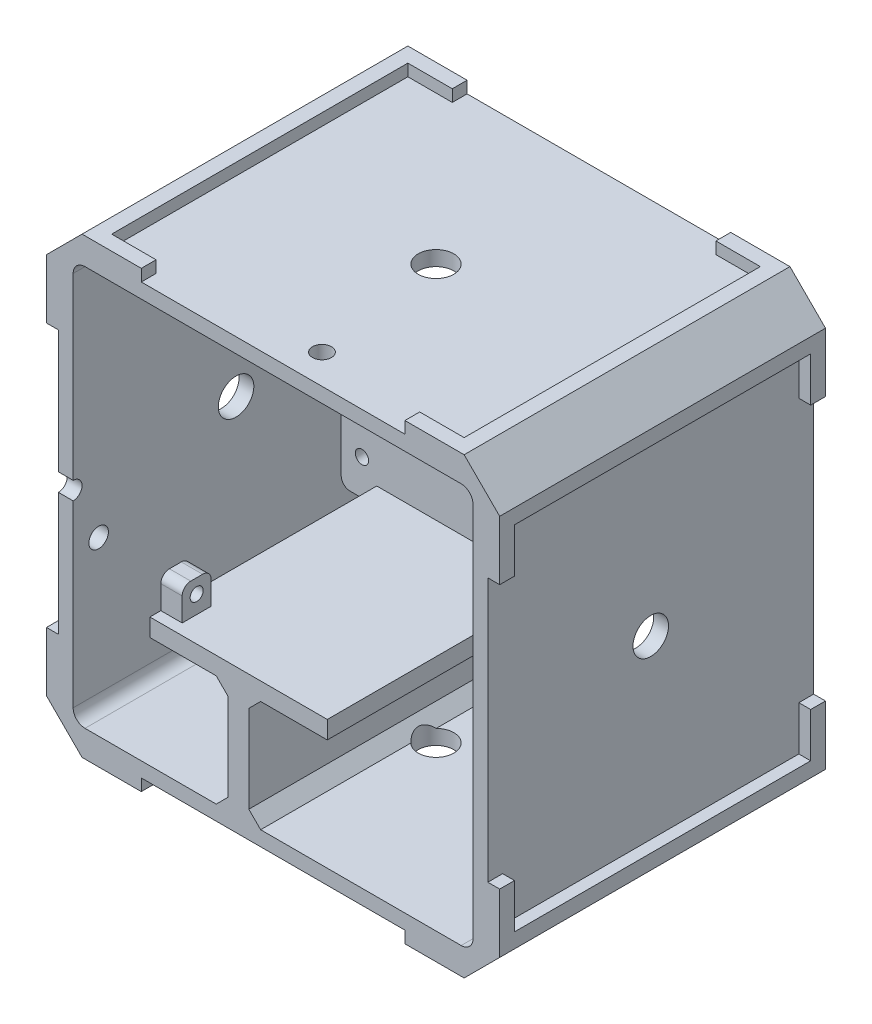
from build123d import *

# Parameters (mm, degrees)
BOSS_EXTRUDE1_DEPTH             = 55
SKETCH2_W                       = 67.5
SKETCH2_H                       = 67.5
BOSS_EXTRUDE2_DEPTH             = 2.5
CUT_EXTRUDE2_REACH              = 77.187
SKETCH4_R                       = 1.65
MIRROR2_COPY_1_REACH            = 77.187
MIRROR2_COPY_1_SKETCH_R         = 1.65
BOSS_EXTRUDE3_DEPTH             = 14.6
BOSS_EXTRUDE3_DEPTH_BACK        = 25.8
BOSS_EXTRUDE4_DEPTH             = 49.7
SKETCH7_W                       = 37.9
SKETCH7_H                       = 22.75
CUT_EXTRUDE3_DEPTH              = 8.4
BOSS_EXTRUDE7_DEPTH             = 2
CUT_EXTRUDE6_REACH              = 84.442
CUT_EXTRUDE6_DIRECTION_2_DEPTH  = 83.442009922
CUT_EXTRUDE8_DEPTH              = 103.907106169
CUT_EXTRUDE8_DEPTH_BACK         = 2.5
SKETCH15_R                      = 1.6
SKETCH16_W                      = 7.5
SKETCH16_H                      = 1.65
BOSS_EXTRUDE8_DEPTH             = 7
CUT_EXTRUDE9_REACH              = 74.438
SKETCH17_R                      = 1.125
SKETCH19_R                      = 3
CUT_EXTRUDE10_DEPTH             = 2.5
BOSS_EXTRUDE9_DEPTH             = 2
CIRPATTERN1_COUNT               = 4
CIRPATTERN2_COUNT               = 4
BOSS_EXTRUDE12_DEPTH            = 55
CUT_EXTRUDE12_REACH             = 75.459
SKETCH23_W                      = 6.5
SKETCH23_H                      = 16
CHAMFER1_SIZE                   = 0.75
CUT_EXTRUDE13_REACH             = 91.486
SKETCH25_W                      = 3
SKETCH25_H                      = 35
SKETCH25_W_2                    = 5
SKETCH25_H_2                    = 46.7
FILLET3_R                       = 1.5
SKETCH26_W                      = 12.543976605
SKETCH26_H                      = 9.586128164
CUT_EXTRUDE14_DEPTH             = 90.261665904
SKETCH27_W                      = 6.75
SKETCH27_H                      = 1.4
BOSS_EXTRUDE14_DEPTH            = 1.25
CHAMFER2_SIZE                   = 2
CUT_EXTRUDE15_REACH             = 85.744
SKETCH28_W                      = 7.624106446
SKETCH28_H                      = 46.373052842
SKETCH29_W                      = 40.4
SKETCH29_H                      = 3
BOSS_EXTRUDE15_DEPTH            = 18.75
BOSS_EXTRUDE16_DEPTH            = 4
CHAMFER3_SIZE                   = 0.75
CHAMFER3_OF_MIRROR3_SIZE        = 0.75
MIRROR4_START                   = 2.5
MIRROR4_DEPTH                   = 4
CUT_EXTRUDE16_REACH             = 102.191
SKETCH32_R                      = 1.5
CUT_EXTRUDE16_DIRECTION_2_DEPTH = 101.19137937
BOSS_EXTRUDE17_DEPTH            = 5
CUT_EXTRUDE17_REACH             = 68.28
SKETCH37_W                      = 5
SKETCH37_H                      = 18.75
SKETCH37_W_2                    = 5.675
BOSS_EXTRUDE18_DEPTH            = 5
BOSS_EXTRUDE19_DEPTH            = 3
FILLET4_R                       = 1.5
FILLET5_R                       = 1.5
SKETCH38_R                      = 1.1
BOSS_EXTRUDE20_DEPTH            = 3.6
SKETCH39_R                      = 1.75
CUT_EXTRUDE18_DEPTH             = 1.4
CUT_EXTRUDE19_REACH             = 102.191
SKETCH40_R                      = 1.65


with BuildPart() as part:
    # Sketch1 → Boss-Extrude1 (new body)
    with BuildSketch(Plane.XY):
        with BuildLine():
            Line((-36.25, 32.25), (-36.25, -32.25))
            ThreePointArc((-36.25, -32.25), (-35.078427125, -35.078427125), (-32.25, -36.25))
            Line((-32.25, -36.25), (32.25, -36.25))
            ThreePointArc((32.25, -36.25), (35.078427125, -35.078427125), (36.25, -32.25))
            Line((36.25, -32.25), (36.25, 32.25))
            ThreePointArc((36.25, 32.25), (35.078427125, 35.078427125), (32.25, 36.25))
            Line((32.25, 36.25), (-32.25, 36.25))
            ThreePointArc((-32.25, 36.25), (-35.078427125, 35.078427125), (-36.25, 32.25))
        make_face()
        with BuildLine():
            Line((-31.75, 33.75), (31.75, 33.75))
            ThreePointArc((31.75, 33.75), (33.164213562, 33.164213562), (33.75, 31.75))
            Line((33.75, 31.75), (33.75, -31.75))
            ThreePointArc((33.75, -31.75), (33.164213562, -33.164213562), (31.75, -33.75))
            Line((31.75, -33.75), (-31.75, -33.75))
            ThreePointArc((-31.75, -33.75), (-33.164213562, -33.164213562), (-33.75, -31.75))
            Line((-33.75, -31.75), (-33.75, 31.75))
            ThreePointArc((-33.75, 31.75), (-33.164213562, 33.164213562), (-31.75, 33.75))
        make_face(mode=Mode.SUBTRACT)
    extrude(amount=BOSS_EXTRUDE1_DEPTH)

    # Sketch2 → Boss-Extrude2 (add)
    with BuildSketch(Plane.XY):
        Rectangle(SKETCH2_W, SKETCH2_H)
    extrude(amount=BOSS_EXTRUDE2_DEPTH)

    # Sketch4 → Cut-Extrude2 (cut, up to next)
    with BuildSketch(Plane(origin=(0, 0, 0), x_dir=(-1, 0, 0), z_dir=(0, 0, -1)), mode=Mode.PRIVATE) as cut_extrude2_sk1:
        with Locations((-28.75, 28.75)):
            Circle(SKETCH4_R)
    cut_extrude2_tool1 = extrude(cut_extrude2_sk1.sketch, amount=-CUT_EXTRUDE2_REACH, mode=Mode.PRIVATE) & part.part
    cut_extrude2 = cut_extrude2_tool1.solids().sort_by_distance((28.75, 28.75, 0))[0]
    add(cut_extrude2, mode=Mode.SUBTRACT)

    # Mirror1: Cut-Extrude2 across plane
    add(cut_extrude2.mirror(Plane(origin=(0, 0, 0), x_dir=(0, 0, 1), z_dir=(1, 0, 0))), mode=Mode.SUBTRACT)

    # Mirror2: Cut-Extrude2 across plane
    add(cut_extrude2.mirror(Plane.ZX), mode=Mode.SUBTRACT)

    # Mirror2 copy 1 sketch → Mirror2 copy 1 (cut, up to next)
    with BuildSketch(Plane(origin=(0, 0, 0), x_dir=(1, 0, 0), z_dir=(0, 0, -1)), mode=Mode.PRIVATE) as mirror2_copy_1_sk1:
        with Locations((-28.75, 28.75)):
            Circle(MIRROR2_COPY_1_SKETCH_R)
    mirror2_copy_1_tool1 = extrude(mirror2_copy_1_sk1.sketch, amount=-MIRROR2_COPY_1_REACH, mode=Mode.PRIVATE) & part.part
    add(mirror2_copy_1_tool1.solids().sort_by_distance((-28.75, -28.75, 0))[0], mode=Mode.SUBTRACT)



with BuildPart() as body_2:
    # Sketch5 → Boss-Extrude3 (new, two sides: drawn at the far end of the back side and taken through both)
    with BuildSketch(Plane(origin=(0, 0, 0), x_dir=(0, 0, -1), z_dir=(1, 0, 0)).offset(-BOSS_EXTRUDE3_DEPTH_BACK)):
        Polygon((-16.7, 12), (-16.7, -12), (-60.4, -12), (-63.4, -12), (-63.4, -15), (-13.7, -15), (-13.7, 12), align=None)
    extrude(amount=BOSS_EXTRUDE3_DEPTH + BOSS_EXTRUDE3_DEPTH_BACK)


with BuildPart() as part_1:
    add(part.part)

    add(body_2.part)  # Boss-Extrude4 merges body 2
    # Sketch6 → Boss-Extrude4 (add)
    with BuildSketch(Plane.XY.offset(63.4)):
        Polygon((-25.8, -12), (12.1, -12), (12.1, -15), (-4.1, -15), (-4.1, -33.75), (12.1, -33.75), (12.1, -36.25), (-25.8, -36.25), (-25.8, -33.75), (-7.6, -33.75), (-7.6, -15), (-25.8, -15), align=None)
    extrude(amount=-BOSS_EXTRUDE4_DEPTH)

    # Sketch7 → Cut-Extrude3 (cut)
    with BuildSketch(Plane.XY.offset(63.4)):
        with Locations((-6.85, -24.875)):
            Rectangle(SKETCH7_W, SKETCH7_H)
    extrude(amount=-CUT_EXTRUDE3_DEPTH, mode=Mode.SUBTRACT)

    # Sketch12 → Boss-Extrude7 (add)
    with BuildSketch(Plane(origin=(0, 36.25, 0), x_dir=(1, 0, 0), z_dir=(0, 1, 0))):
        Polygon((29.75, -55), (32.25, -55), (32.25, -52.5), (32.25, -45), (29.75, -45), (29.75, -52.5), (22.25, -52.5), (22.25, -55), align=None)
        Polygon((-32.25, 0), (-32.25, -10), (-29.75, -10), (-29.75, -2.5), (-22.25, -2.5), (-22.25, 0), align=None)
    boss_extrude7 = extrude(amount=BOSS_EXTRUDE7_DEPTH)

    # Sketch13 → Cut-Extrude6 (cut, up to next)
    with BuildSketch(Plane(origin=(0, 0, 0), x_dir=(-1, 0, 0), z_dir=(0, 0, -1)), mode=Mode.PRIVATE) as cut_extrude6_sk1:
        with BuildLine():
            Line((-33.75, 21.25), (-25.25, 21.25))
            ThreePointArc((-25.25, 21.25), (-22.421572875, 22.421572875), (-21.25, 25.25))
            Line((-21.25, 25.25), (-21.25, 33.75))
            Line((-21.25, 33.75), (21.25, 33.75))
            Line((21.25, 33.75), (21.25, 25.25))
            ThreePointArc((21.25, 25.25), (22.421572875, 22.421572875), (25.25, 21.25))
            Line((25.25, 21.25), (33.75, 21.25))
            Line((33.75, 21.25), (33.75, -21.25))
            Line((33.75, -21.25), (25.25, -21.25))
            ThreePointArc((25.25, -21.25), (22.421572875, -22.421572875), (21.25, -25.25))
            Line((21.25, -25.25), (21.25, -33.75))
            Line((21.25, -33.75), (-21.25, -33.75))
            Line((-21.25, -33.75), (-21.25, -25.25))
            ThreePointArc((-21.25, -25.25), (-22.421572875, -22.421572875), (-25.25, -21.25))
            Line((-25.25, -21.25), (-33.75, -21.25))
            Line((-33.75, -21.25), (-33.75, 21.25))
        make_face()
    cut_extrude6_tool1 = extrude(cut_extrude6_sk1.sketch, amount=-CUT_EXTRUDE6_REACH, mode=Mode.PRIVATE) & part_1.part
    add(cut_extrude6_tool1.solids().sort_by_distance((0, 0, 0))[0], mode=Mode.SUBTRACT)

    # Sketch13 → Cut-Extrude6 direction 2 (cut)
    with BuildSketch(Plane(origin=(0, 0, 0), x_dir=(-1, 0, 0), z_dir=(0, 0, -1))):
        with BuildLine():
            Line((-33.75, 21.25), (-25.25, 21.25))
            ThreePointArc((-25.25, 21.25), (-22.421572875, 22.421572875), (-21.25, 25.25))
            Line((-21.25, 25.25), (-21.25, 33.75))
            Line((-21.25, 33.75), (21.25, 33.75))
            Line((21.25, 33.75), (21.25, 25.25))
            ThreePointArc((21.25, 25.25), (22.421572875, 22.421572875), (25.25, 21.25))
            Line((25.25, 21.25), (33.75, 21.25))
            Line((33.75, 21.25), (33.75, -21.25))
            Line((33.75, -21.25), (25.25, -21.25))
            ThreePointArc((25.25, -21.25), (22.421572875, -22.421572875), (21.25, -25.25))
            Line((21.25, -25.25), (21.25, -33.75))
            Line((21.25, -33.75), (-21.25, -33.75))
            Line((-21.25, -33.75), (-21.25, -25.25))
            ThreePointArc((-21.25, -25.25), (-22.421572875, -22.421572875), (-25.25, -21.25))
            Line((-25.25, -21.25), (-33.75, -21.25))
            Line((-33.75, -21.25), (-33.75, 21.25))
        make_face()
    extrude(amount=CUT_EXTRUDE6_DIRECTION_2_DEPTH, mode=Mode.SUBTRACT)

    # Sketch15 → Cut-Extrude8 (cut, two sides: drawn at the far end of the back side and taken through both)
    with BuildSketch(Plane(origin=(0, 36.25, 0), x_dir=(1, 0, 0), z_dir=(0, 1, 0)).offset(-CUT_EXTRUDE8_DEPTH_BACK)):
        with Locations(Location((3.25, -50, 0), (0, 0, 270))):
            Circle(SKETCH15_R)
    extrude(amount=CUT_EXTRUDE8_DEPTH + CUT_EXTRUDE8_DEPTH_BACK, mode=Mode.SUBTRACT)

    # Sketch16 → Boss-Extrude8 (add)
    with BuildSketch(Plane(origin=(-33.75, 0, 0), x_dir=(0, 0, -1), z_dir=(1, 0, 0))):
        with Locations((-16.5, 29.525)):
            Rectangle(SKETCH16_W, SKETCH16_H)
    extrude(amount=BOSS_EXTRUDE8_DEPTH)

    # Sketch17 → Cut-Extrude9 (cut, up to next)
    with BuildSketch(Plane(origin=(0, 0, 13.7), x_dir=(-1, 0, 0), z_dir=(0, 0, -1)), mode=Mode.PRIVATE) as cut_extrude9_sk1:
        with Locations(Location((-12.1, 9, 0), (0, 0, 90))):
            Circle(SKETCH17_R)
    cut_extrude9_tool1 = extrude(cut_extrude9_sk1.sketch, amount=-CUT_EXTRUDE9_REACH, mode=Mode.PRIVATE) & part_1.part
    # Sketch17 → Cut-Extrude9 (cut, up to next)
    with BuildSketch(Plane(origin=(0, 0, 13.7), x_dir=(-1, 0, 0), z_dir=(0, 0, -1)), mode=Mode.PRIVATE) as cut_extrude9_sk2:
        with Locations(Location((-12.1, -9, 0), (0, 0, 90))):
            Circle(SKETCH17_R)
    cut_extrude9_tool2 = extrude(cut_extrude9_sk2.sketch, amount=-CUT_EXTRUDE9_REACH, mode=Mode.PRIVATE) & part_1.part
    # Sketch17 → Cut-Extrude9 (cut, up to next)
    with BuildSketch(Plane(origin=(0, 0, 13.7), x_dir=(-1, 0, 0), z_dir=(0, 0, -1)), mode=Mode.PRIVATE) as cut_extrude9_sk3:
        with Locations(Location((23.3, -9, 0), (0, 0, 90))):
            Circle(SKETCH17_R)
    cut_extrude9_tool3 = extrude(cut_extrude9_sk3.sketch, amount=-CUT_EXTRUDE9_REACH, mode=Mode.PRIVATE) & part_1.part
    add(cut_extrude9_tool1.solids().sort_by_distance((12.1, 9, 13.7))[0], mode=Mode.SUBTRACT)
    add(cut_extrude9_tool2.solids().sort_by_distance((12.1, -9, 13.7))[0], mode=Mode.SUBTRACT)
    add(cut_extrude9_tool3.solids().sort_by_distance((-23.3, -9, 13.7))[0], mode=Mode.SUBTRACT)

    # Sketch19 → Cut-Extrude10 (cut)
    with BuildSketch(Plane(origin=(0, 36.25, 0), x_dir=(1, 0, 0), z_dir=(0, 1, 0))):
        with Locations(Location((0, -27.5, 0), (0, 0, 270))):
            Circle(SKETCH19_R)
    cut_extrude10 = extrude(amount=-CUT_EXTRUDE10_DEPTH, mode=Mode.SUBTRACT)

    # Sketch20 → Boss-Extrude9 (add)
    with BuildSketch(Plane(origin=(36.25, 0, -36.25), x_dir=(0, 0, 1), z_dir=(-1, 0, 0))):
        Polygon((91.25, 32.25), (81.25, 32.25), (81.25, 29.75), (88.75, 29.75), (88.75, 22.25), (91.25, 22.25), align=None)
        Polygon((36.25, -22.25), (36.25, -32.25), (46.25, -32.25), (46.25, -29.75), (38.75, -29.75), (38.75, -22.25), align=None)
    boss_extrude9 = extrude(amount=-BOSS_EXTRUDE9_DEPTH)

    # CirPattern1: Boss-Extrude7, Cut-Extrude10 ×4 about axis
    cirpattern1_axis = Axis((0, 0, 0), (0, 0, 1))
    add([boss_extrude7.rotate(cirpattern1_axis, i * 360 / CIRPATTERN1_COUNT) for i in range(1, CIRPATTERN1_COUNT)])
    add([cut_extrude10.rotate(cirpattern1_axis, i * 360 / CIRPATTERN1_COUNT) for i in range(1, CIRPATTERN1_COUNT)], mode=Mode.SUBTRACT)

    # CirPattern2: Boss-Extrude9 ×4 about axis
    cirpattern2_axis = Axis((0, 0, 0), (0, 0, 1))
    for i in range(1, CIRPATTERN2_COUNT):
        add(boss_extrude9.rotate(cirpattern2_axis, i * 360 / CIRPATTERN2_COUNT))

    # Sketch22 → Boss-Extrude12 (add, through all)
    with BuildSketch(Plane.XY.offset(55)):
        Polygon((-38.25, 32.25), (-32.25, 38.25), (-29.75, 38.25), (-29.75, 33.75), (-33.75, 33.75), (-33.75, 29.75), (-38.25, 29.75), align=None)
        Polygon((33.75, 33.75), (33.75, 29.75), (38.25, 29.75), (38.25, 32.25), (32.25, 38.25), (29.75, 38.25), (29.75, 33.75), align=None)
        Polygon((38.25, -32.25), (32.25, -38.25), (29.75, -38.25), (29.75, -33.75), (33.75, -33.75), (33.75, -29.75), (38.25, -29.75), align=None)
        Polygon((-33.75, -33.75), (-33.75, -29.75), (-38.25, -29.75), (-38.25, -32.25), (-32.25, -38.25), (-29.75, -38.25), (-29.75, -33.75), align=None)
    extrude(amount=-BOSS_EXTRUDE12_DEPTH)

    # Sketch23 → Cut-Extrude12 (cut, up to next)
    with BuildSketch(Plane(origin=(0, 0, 13.7), x_dir=(-1, 0, 0), z_dir=(0, 0, -1)), mode=Mode.PRIVATE) as cut_extrude12_sk1:
        with Locations((22.55, 4)):
            Rectangle(SKETCH23_W, SKETCH23_H)
    cut_extrude12_tool1 = extrude(cut_extrude12_sk1.sketch, amount=-CUT_EXTRUDE12_REACH, mode=Mode.PRIVATE) & part_1.part
    add(cut_extrude12_tool1.solids().sort_by_distance((-22.55, 4, 13.7))[0], mode=Mode.SUBTRACT)

    # Chamfer1
    chamfer1_edges = [part_1.edges().sort_by_distance(p)[0] for p in [
        (-33.75, 28.7, 16.5),
        (-30.25, 30.35, 20.25),
        (-26.75, 30.35, 16.5),
    ]]
    chamfer(chamfer1_edges, length=CHAMFER1_SIZE)

    # Sketch25 → Cut-Extrude13 (cut, up to next)
    with BuildSketch(Plane(origin=(0, -12, 0), x_dir=(1, 0, 0), z_dir=(0, 1, 0)), mode=Mode.PRIVATE) as cut_extrude13_sk1:
        with Locations((13.1, -45.9)):
            Rectangle(SKETCH25_W, SKETCH25_H)
    cut_extrude13_tool1 = extrude(cut_extrude13_sk1.sketch, amount=-CUT_EXTRUDE13_REACH, mode=Mode.PRIVATE) & part_1.part
    # Sketch25 → Cut-Extrude13 (cut, up to next)
    with BuildSketch(Plane(origin=(0, -12, 0), x_dir=(1, 0, 0), z_dir=(0, 1, 0)), mode=Mode.PRIVATE) as cut_extrude13_sk2:
        with Locations((-23.3, -40.05)):
            Rectangle(SKETCH25_W_2, SKETCH25_H_2)
    cut_extrude13_tool2 = extrude(cut_extrude13_sk2.sketch, amount=-CUT_EXTRUDE13_REACH, mode=Mode.PRIVATE) & part_1.part
    add(cut_extrude13_tool1.solids().sort_by_distance((13.1, -12, 45.9))[0], mode=Mode.SUBTRACT)
    add(cut_extrude13_tool2.solids().sort_by_distance((-23.3, -12, 40.05))[0], mode=Mode.SUBTRACT)

    # Fillet3
    fillet3_edges = [part_1.edges().sort_by_distance(p)[0] for p in [
        (-19.3, -4, 15.2),
        (-19.3, 12, 15.2),
        (-25.8, -4, 15.2),
    ]]
    fillet(fillet3_edges, radius=FILLET3_R)

    # Sketch26 → Cut-Extrude14 (cut, through all)
    with BuildSketch(Plane(origin=(11.6, 0, 0), x_dir=(0, 0, -1), z_dir=(1, 0, 0))):
        with Locations((-61.271988302, -13.249120227)):
            Rectangle(SKETCH26_W, SKETCH26_H)
    extrude(amount=-CUT_EXTRUDE14_DEPTH, mode=Mode.SUBTRACT)

    # Sketch27 → Boss-Extrude14 (add)
    with BuildSketch(Plane(origin=(-33.75, 0, 0), x_dir=(0, 0, -1), z_dir=(1, 0, 0))):
        with Locations((-16.125, 31.05)):
            Rectangle(SKETCH27_W, SKETCH27_H)
    extrude(amount=BOSS_EXTRUDE14_DEPTH)

    # Chamfer2
    # the kernel refuses this chamfer: 2 mm, written as the material it adds along each edge
    with BuildSketch(Plane(origin=(-4.1, -33.75, 13.7), x_dir=(1, 0, 0), z_dir=(0, 0, 1))) as chamfer2_piece_1_section:
        Polygon((CHAMFER2_SIZE, 0), (0, CHAMFER2_SIZE), (0, 0), align=None)
    chamfer2_piece_1 = extrude(amount=41.3, mode=Mode.PRIVATE)
    chamfer2_piece_1 = chamfer2_piece_1 - Plane(origin=(0, -33.75, 27.5), x_dir=(0, 0, 1), z_dir=(0, -1, 0)) * Cylinder(3, 91, mode=Mode.PRIVATE)
    add(chamfer2_piece_1)
    with BuildSketch(Plane(origin=(-4.1, -15, 55), x_dir=(0, -1, 0), z_dir=(0, 0, -1)), Plane(origin=(-7.6, -33.75, 55), x_dir=(0, 1, 0), z_dir=(0, 0, -1))) as chamfer2_piece_2:
        Polygon((CHAMFER2_SIZE, 0), (0, -CHAMFER2_SIZE), (0, 0), align=None)
    extrude(amount=41.3)
    with BuildSketch(Plane(origin=(-7.6, -15, 55), x_dir=(0, -1, 0), z_dir=(0, 0, -1))) as chamfer2_piece_3:
        Polygon((CHAMFER2_SIZE, 0), (0, CHAMFER2_SIZE), (0, 0), align=None)
    extrude(amount=41.3)

    # Sketch28 → Cut-Extrude15 (cut, up to next)
    with BuildSketch(Plane(origin=(0, -12, 0), x_dir=(1, 0, 0), z_dir=(0, 1, 0)), mode=Mode.PRIVATE) as cut_extrude15_sk1:
        with Locations((12.962053223, -39.886526421)):
            Rectangle(SKETCH28_W, SKETCH28_H)
    cut_extrude15_tool1 = extrude(cut_extrude15_sk1.sketch, amount=-CUT_EXTRUDE15_REACH, mode=Mode.PRIVATE) & part_1.part
    add(cut_extrude15_tool1.solids().sort_by_distance((12.962053, -12, 39.886526))[0], mode=Mode.SUBTRACT)

    # Sketch29 → Boss-Extrude15 (add)
    with BuildSketch(Plane(origin=(0, -15, 0), x_dir=(-1, 0, 0), z_dir=(0, -1, 0))):
        with Locations((5.6, -15.2)):
            Rectangle(SKETCH29_W, SKETCH29_H)
    extrude(amount=BOSS_EXTRUDE15_DEPTH)

    # Sketch31 → Boss-Extrude16 (add)
    with BuildSketch(Plane.XY.offset(2.5)):
        with BuildLine():
            Line((-33.75, 21.25), (-33.75, 33.75))
            Line((-33.75, 33.75), (-21.25, 33.75))
            Line((-21.25, 33.75), (-21.25, 25.25))
            ThreePointArc((-21.25, 25.25), (-22.421572875, 22.421572875), (-25.25, 21.25))
            Line((-25.25, 21.25), (-33.75, 21.25))
        make_face()
        Polygon((-28.75, 32.069764048), (-31.625, 30.409882024), (-31.625, 27.090117976), (-28.75, 25.430235952), (-25.875, 27.090117976), (-25.875, 30.409882024), align=None, mode=Mode.SUBTRACT)
    boss_extrude16 = extrude(amount=BOSS_EXTRUDE16_DEPTH)

    # Chamfer3
    chamfer3_edges = [part_1.edges().sort_by_distance(p)[0] for p in [
        (-27.3125, 31.239823036, 6.5),
        (-30.1875, 31.239823036, 6.5),
        (-31.625, 28.75, 6.5),
        (-30.1875, 26.260176964, 6.5),
        (-27.3125, 26.260176964, 6.5),
        (-25.875, 28.75, 6.5),
    ]]
    chamfer(chamfer3_edges, length=CHAMFER3_SIZE)

    # Mirror3: Boss-Extrude16 across plane
    add(boss_extrude16.mirror(Plane(origin=(0, 0, 0), x_dir=(0, 0, 1), z_dir=(1, 0, 0))))

    # Chamfer3 of Mirror3
    chamfer3_of_mirror3_edges = [part_1.edges().sort_by_distance(p)[0] for p in [
        (27.3125, 31.239823036, 6.5),
        (30.1875, 31.239823036, 6.5),
        (31.625, 28.75, 6.5),
        (30.1875, 26.260176964, 6.5),
        (27.3125, 26.260176964, 6.5),
        (25.875, 28.75, 6.5),
    ]]
    chamfer(chamfer3_of_mirror3_edges, length=CHAMFER3_OF_MIRROR3_SIZE)

    # Mirror4: read off the stored shape, not the designer's step
    # Mirror4 outline → Mirror4 (add)
    # profile 1 of 2: a face of its own
    with BuildSketch(Plane.XY.offset(MIRROR4_START)):
        with BuildLine():
            Line((33.75, -31.75), (33.75, -21.25))
            Line((33.75, -21.25), (25.25, -21.25))
            ThreePointArc((25.25, -21.25), (22.421572875, -22.421572875), (21.25, -25.25))
            Line((21.25, -25.25), (21.25, -33.75))
            Line((21.25, -33.75), (31.75, -33.75))
            ThreePointArc((31.75, -33.75), (33.164213562, -33.164213562), (33.75, -31.75))
        make_face()
        Polygon((28.75, -32.069764048), (25.875, -30.409882024), (25.875, -27.090117976), (28.75, -25.430235952), (31.625, -27.090117976), (31.625, -30.409882024), align=None, mode=Mode.SUBTRACT)
    # profile 2 of 2: a face of its own
    with BuildSketch(Plane.XY.offset(MIRROR4_START)):
        with BuildLine():
            Line((-31.75, -33.75), (-21.25, -33.75))
            Line((-21.25, -33.75), (-21.25, -25.25))
            ThreePointArc((-21.25, -25.25), (-22.421572875, -22.421572875), (-25.25, -21.25))
            Line((-25.25, -21.25), (-33.75, -21.25))
            Line((-33.75, -21.25), (-33.75, -31.75))
            ThreePointArc((-33.75, -31.75), (-33.164213562, -33.164213562), (-31.75, -33.75))
        make_face()
        Polygon((-31.625, -30.409882024), (-31.625, -27.090117976), (-28.75, -25.430235952), (-25.875, -27.090117976), (-25.875, -30.409882024), (-28.75, -32.069764048), align=None, mode=Mode.SUBTRACT)
    extrude(amount=MIRROR4_DEPTH)

    # Mirror4 2: loft between two sections, ruled curve by curve
    mirror4_2_from = [
        Edge.make_line((-25.875, -27.090117976, 5.75), (-25.875, -30.409882024, 5.75)),
        Edge.make_line((-31.625, -30.409882024, 5.75), (-31.625, -27.090117976, 5.75)),
        Edge.make_line((-25.875, -30.409882024, 5.75), (-28.75, -32.069764048, 5.75)),
        Edge.make_line((-25.875, -27.090117976, 5.75), (-28.75, -25.430235952, 5.75)),
        Edge.make_line((-28.75, -32.069764048, 5.75), (-31.625, -30.409882024, 5.75)),
        Edge.make_line((-28.75, -25.430235952, 5.75), (-31.625, -27.090117976, 5.75)),
    ]
    mirror4_2_to = [
        Edge.make_line((-25.125, -26.657105274, 6.5), (-25.125, -30.842894726, 6.5)),
        Edge.make_line((-32.375, -30.842894726, 6.5), (-32.375, -26.657105274, 6.5)),
        Edge.make_line((-25.125, -30.842894726, 6.5), (-28.75, -32.935789452, 6.5)),
        Edge.make_line((-25.125, -26.657105274, 6.5), (-28.75, -24.564210548, 6.5)),
        Edge.make_line((-28.75, -32.935789452, 6.5), (-32.375, -30.842894726, 6.5)),
        Edge.make_line((-28.75, -24.564210548, 6.5), (-32.375, -26.657105274, 6.5)),
    ]
    mirror4_2 = Solid(Shell([*[Face.make_surface_from_curves(mirror4_2_from[k], mirror4_2_to[k]) for k in range(6)], Face(Wire(mirror4_2_from)), Face(Wire(mirror4_2_to))]))
    add(mirror4_2, mode=Mode.SUBTRACT)

    # Mirror4 3: loft between two sections, ruled curve by curve
    mirror4_3_from = [
        Edge.make_line((25.875, -27.090117976, 5.75), (25.875, -30.409882024, 5.75)),
        Edge.make_line((31.625, -30.409882024, 5.75), (31.625, -27.090117976, 5.75)),
        Edge.make_line((25.875, -30.409882024, 5.75), (28.75, -32.069764048, 5.75)),
        Edge.make_line((25.875, -27.090117976, 5.75), (28.75, -25.430235952, 5.75)),
        Edge.make_line((28.75, -32.069764048, 5.75), (31.625, -30.409882024, 5.75)),
        Edge.make_line((28.75, -25.430235952, 5.75), (31.625, -27.090117976, 5.75)),
    ]
    mirror4_3_to = [
        Edge.make_line((25.125, -26.657105274, 6.5), (25.125, -30.842894726, 6.5)),
        Edge.make_line((32.375, -30.842894726, 6.5), (32.375, -26.657105274, 6.5)),
        Edge.make_line((25.125, -30.842894726, 6.5), (28.75, -32.935789452, 6.5)),
        Edge.make_line((25.125, -26.657105274, 6.5), (28.75, -24.564210548, 6.5)),
        Edge.make_line((28.75, -32.935789452, 6.5), (32.375, -30.842894726, 6.5)),
        Edge.make_line((28.75, -24.564210548, 6.5), (32.375, -26.657105274, 6.5)),
    ]
    mirror4_3 = Solid(Shell([*[Face.make_surface_from_curves(mirror4_3_from[k], mirror4_3_to[k]) for k in range(6)], Face(Wire(mirror4_3_from)), Face(Wire(mirror4_3_to))]))
    add(mirror4_3, mode=Mode.SUBTRACT)

    # Sketch32 → Cut-Extrude16 (cut, up to next)
    with BuildSketch(Plane.ZY.offset(36.25), mode=Mode.PRIVATE) as cut_extrude16_sk1:
        with Locations((55, 0)):
            Circle(SKETCH32_R)
    cut_extrude16_tool1 = extrude(cut_extrude16_sk1.sketch, amount=-CUT_EXTRUDE16_REACH, mode=Mode.PRIVATE) & part_1.part
    add(cut_extrude16_tool1.solids().sort_by_distance((-36.25, 0, 55))[0], mode=Mode.SUBTRACT)

    # Sketch32 → Cut-Extrude16 direction 2 (cut)
    with BuildSketch(Plane.ZY.offset(36.25)):
        with Locations((55, 0)):
            Circle(SKETCH32_R)
    extrude(amount=CUT_EXTRUDE16_DIRECTION_2_DEPTH, mode=Mode.SUBTRACT)

    # Sketch34 → Boss-Extrude17 (add)
    with BuildSketch(Plane(origin=(0, -2.5, 0), x_dir=(1, 0, 0), z_dir=(0, 1, 0))):
        Polygon((33.75, 0), (26.25, 0), (26.25, -5), (28.25, -5), (28.25, -2), (33.75, -2), align=None)
    extrude(amount=BOSS_EXTRUDE17_DEPTH)

    # Sketch37 → Cut-Extrude17 (cut, up to next)
    with BuildSketch(Plane.XY.offset(16.7), mode=Mode.PRIVATE) as cut_extrude17_sk1:
        with Locations((-23.3, -24.375)):
            Rectangle(SKETCH37_W, SKETCH37_H)
    cut_extrude17_tool1 = extrude(cut_extrude17_sk1.sketch, amount=-CUT_EXTRUDE17_REACH, mode=Mode.PRIVATE) & part_1.part
    # Sketch37 → Cut-Extrude17 (cut, up to next)
    with BuildSketch(Plane.XY.offset(16.7), mode=Mode.PRIVATE) as cut_extrude17_sk2:
        with Locations((11.9875, -24.375)):
            Rectangle(SKETCH37_W_2, SKETCH37_H)
    cut_extrude17_tool2 = extrude(cut_extrude17_sk2.sketch, amount=-CUT_EXTRUDE17_REACH, mode=Mode.PRIVATE) & part_1.part
    add(cut_extrude17_tool1.solids().sort_by_distance((-23.3, -24.375, 16.7))[0], mode=Mode.SUBTRACT)
    add(cut_extrude17_tool2.solids().sort_by_distance((11.9875, -24.375, 16.7))[0], mode=Mode.SUBTRACT)

    # Sketch35 → Boss-Extrude18 (add)
    with BuildSketch(Plane(origin=(0, -4.5, 0), x_dir=(1, 0, 0), z_dir=(0, 1, 0))):
        Polygon((28.25, 0), (28.25, -3), (33.75, -3), (33.75, -5), (26.25, -5), (26.25, 0), align=None)
    extrude(amount=-BOSS_EXTRUDE18_DEPTH)

    # Sketch36 → Boss-Extrude19 (add)
    with BuildSketch(Plane(origin=(0, 0, 13.7), x_dir=(-1, 0, 0), z_dir=(0, 0, -1))):
        Polygon((-15.6, 12.5), (-15.6, -15), (-14.6, -15), (-14.052921839, 10.290373182), (-8.498490792, 11.115288684), (18.340009821, -8.537374602), (24.897997882, -6.724757663), (25.8, -15), (26.8, -15), (26.8, -4), (19.3, 12.5), align=None)
    extrude(amount=-BOSS_EXTRUDE19_DEPTH)

    # Fillet4
    fillet4_edges = [part_1.edges().sort_by_distance(p)[0] for p in [
        (3.525, -33.75, 16.7),
        (-15.2, -33.75, 16.7),
        (-5.825, -33.75, 13.7),
        (-20.8, -33.75, 15.2),
        (9.15, -33.75, 15.2),
    ]]
    fillet(fillet4_edges, radius=FILLET4_R)

    # Fillet5
    # the kernel refuses this fillet: 1.5 mm, written as the material it adds along each edge
    with BuildSketch(Plane(origin=(-20.8, -15, 16.7), x_dir=(0, -1, 0), z_dir=(0, 0, -1))) as fillet5_piece_1:
        with BuildLine():
            CenterArc((FILLET5_R, FILLET5_R), FILLET5_R, 180, 90)
            Line((0, FILLET5_R), (0, 0))
            Line((0, 0), (FILLET5_R, 0))
        make_face()
    extrude(amount=3)
    with BuildSketch(Plane(origin=(9.15, -15, 16.7), x_dir=(0, -1, 0), z_dir=(0, 0, -1))) as fillet5_piece_2:
        with BuildLine():
            CenterArc((FILLET5_R, -FILLET5_R), FILLET5_R, 90, 90)
            Line((0, -FILLET5_R), (0, 0))
            Line((0, 0), (FILLET5_R, 0))
        make_face()
    extrude(amount=3)
    # the kernel refuses this fillet: 1.5 mm, written as the material it takes off along each edge
    with BuildSketch(Plane(origin=(-26.8, -15, 9.95), x_dir=(0, 1, 0), z_dir=(0, 0, 1)), Plane(origin=(15.6, 12.5, 9.95), x_dir=(0, -1, 0), z_dir=(0, 0, 1)), Plane(origin=(15.6, -15, 9.95), x_dir=(-1, 0, 0), z_dir=(0, 0, 1))) as fillet5_2_piece_1:
        with BuildLine():
            CenterArc((FILLET5_R, -FILLET5_R), FILLET5_R, 90, 90)
            Line((0, -FILLET5_R), (0, 0))
            Line((0, 0), (FILLET5_R, 0))
        make_face()
    extrude(amount=10.5, mode=Mode.SUBTRACT)
    with BuildSketch(Plane(origin=(-26.8, -4, 12.88771552), x_dir=(0.4138029443011817, 0.9103664774626058, 0), z_dir=(0, 0, 1))) as fillet5_2_piece_2:
        with BuildLine():
            CenterArc((FILLET5_R * 0.216609194719, -FILLET5_R), FILLET5_R, 90, 24.44395478)
            Line((-FILLET5_R * 0.197193749582, -FILLET5_R * 0.0896335225374), (0, 0))
            Line((0, 0), (FILLET5_R * 0.216609194719, 0))
        make_face()
    extrude(amount=4.62456896, mode=Mode.SUBTRACT)
    with BuildSketch(Plane(origin=(-19.3, 12.5, 11.285325236), x_dir=(1, 0, 0), z_dir=(0, 0, 1))) as fillet5_2_piece_3:
        with BuildLine():
            CenterArc((FILLET5_R * 0.643913270327, -FILLET5_R), FILLET5_R, 90, 65.55604522)
            Line((-FILLET5_R * 0.266453207136, -FILLET5_R * 0.586197055699), (0, 0))
            Line((0, 0), (FILLET5_R * 0.643913270327, 0))
        make_face()
    extrude(amount=7.829349527, mode=Mode.SUBTRACT)

    # Sketch38 → Boss-Extrude20 (add)
    with BuildSketch(Plane.ZY.offset(20.8)):
        with BuildLine():
            Line((48.25, -12), (53.15, -12))
            Line((53.15, -12), (53.15, -8.05))
            ThreePointArc((53.15, -8.05), (52.725304833, -7.024695167), (51.7, -6.6))
            Line((51.7, -6.6), (49.7, -6.6))
            ThreePointArc((49.7, -6.6), (48.674695167, -7.024695167), (48.25, -8.05))
            Line((48.25, -8.05), (48.25, -12))
        make_face()
        with Locations((50.7, -9)):
            Circle(SKETCH38_R, mode=Mode.SUBTRACT)
    extrude(amount=-BOSS_EXTRUDE20_DEPTH)

    # Sketch39 → Cut-Extrude18 (cut)
    with BuildSketch(Plane.ZY.offset(20.8)):
        with Locations((50.7, -9)):
            Circle(SKETCH39_R)
    extrude(amount=-CUT_EXTRUDE18_DEPTH, mode=Mode.SUBTRACT)

    # Sketch40 → Cut-Extrude19 (cut, up to next)
    with BuildSketch(Plane.ZY.offset(36.25), mode=Mode.PRIVATE) as cut_extrude19_sk1:
        with Locations((50.7, -9)):
            Circle(SKETCH40_R)
    cut_extrude19_tool1 = extrude(cut_extrude19_sk1.sketch, amount=-CUT_EXTRUDE19_REACH, mode=Mode.PRIVATE) & part_1.part
    add(cut_extrude19_tool1.solids().sort_by_distance((-36.25, -9, 50.7))[0], mode=Mode.SUBTRACT)


solid = part_1.part
